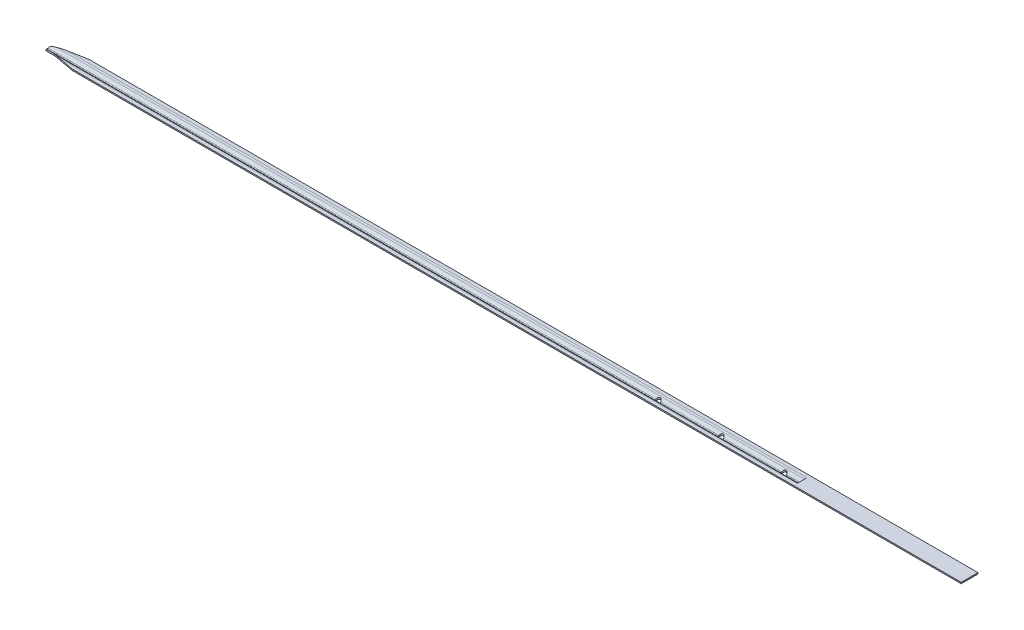
from build123d import *

# Parameters (mm, degrees)
EXTRUDE_1_DEPTH          = 900
SKETCH_6_W               = 20
SKETCH_6_H               = 1.5
EXTRUDE_2_DEPTH          = 200
CUT_EXTRUDE_1_DEPTH      = 901.06900951
CUT_EXTRUDE_1_DEPTH_BACK = 901.06900951
CUT_EXTRUDE_2_DEPTH      = 901.06900961
CUT_EXTRUDE_2_DEPTH_BACK = 901.06900961
SKETCH_3_R               = 3


with BuildPart() as part:
    # Эскиз5 → Бобышка-Вытянуть1 (new body)
    with BuildSketch(Plane(origin=(0, 0, 0), x_dir=(0, 0, -1), z_dir=(1, 0, 0))):
        with BuildLine():
            Line((-10, -0.75), (-5.828427125, -0.75))
            ThreePointArc((-5.828427125, -0.75), (-5.350072834, -0.845150584), (-4.944543648, -1.116116524))
            Line((-4.944543648, -1.116116524), (-1.944543648, -4.116116524))
            ThreePointArc((-1.944543648, -4.116116524), (0, -4.921572875), (1.944543648, -4.116116524))
            Line((1.944543648, -4.116116524), (4.944543648, -1.116116524))
            ThreePointArc((4.944543648, -1.116116524), (5.350072834, -0.845150584), (5.828427125, -0.75))
            Line((5.828427125, -0.75), (10, -0.75))
            Line((10, -0.75), (10, 0.75))
            Line((10, 0.75), (5.828427125, 0.75))
            ThreePointArc((5.828427125, 0.75), (4.776047686, 0.540668714), (3.883883476, -0.055456352))
            Line((3.883883476, -0.055456352), (0.883883476, -3.055456352))
            ThreePointArc((0.883883476, -3.055456352), (0, -3.421572875), (-0.883883476, -3.055456352))
            Line((-0.883883476, -3.055456352), (-3.883883476, -0.055456352))
            ThreePointArc((-3.883883476, -0.055456352), (-4.776047686, 0.540668714), (-5.828427125, 0.75))
            Line((-5.828427125, 0.75), (-10, 0.75))
            Line((-10, 0.75), (-10, -0.75))
        make_face()
    extrude(amount=-EXTRUDE_1_DEPTH)

    # Эскиз6 → Бобышка-Вытянуть2 (add)
    with BuildSketch(Plane(origin=(0, 0, 0), x_dir=(0, 0, -1), z_dir=(1, 0, 0))):
        Rectangle(SKETCH_6_W, SKETCH_6_H)
    extrude(amount=EXTRUDE_2_DEPTH)

    # Эскиз2 → Вырез-Вытянуть1 (cut, two sides: drawn at the far end of the back side and taken through both)
    with BuildSketch(Plane(origin=(0, 0, 0), x_dir=(1, 0, 0), z_dir=(0, 1, 0)).offset(-CUT_EXTRUDE_1_DEPTH_BACK)):
        with BuildLine():
            Line((1233.785324309, -403.154628875), (-860, -10))
            Line((-860, -10), (-897.553640838, -2.948471099))
            ThreePointArc((-897.553640838, -2.948471099), (-900, 0), (-897.553640838, 2.948471099))
            Line((-897.553640838, 2.948471099), (-860, 10))
            Line((-860, 10), (1233.785324309, 403.154628875))
            Line((1233.785324309, 403.154628875), (-3026.969325514, 403.154628875))
            Line((-3026.969325514, 403.154628875), (-3026.969325514, -403.154628875))
            Line((-3026.969325514, -403.154628875), (1233.785324309, -403.154628875))
        make_face()
    extrude(amount=CUT_EXTRUDE_1_DEPTH + CUT_EXTRUDE_1_DEPTH_BACK, mode=Mode.SUBTRACT)

    # Эскиз3 → Вырез-Вытянуть2 (cut, two sides: drawn at the far end of the back side and taken through both)
    with BuildSketch(Plane(origin=(0, 0, 0), x_dir=(1, 0, 0), z_dir=(0, 1, 0)).offset(-CUT_EXTRUDE_2_DEPTH_BACK)):
        with Locations((-22, 0)):
            Circle(SKETCH_3_R)
        with Locations((-172, 0)):
            Circle(SKETCH_3_R)
        with Locations((-97, 0)):
            Circle(SKETCH_3_R)
    extrude(amount=CUT_EXTRUDE_2_DEPTH + CUT_EXTRUDE_2_DEPTH_BACK, mode=Mode.SUBTRACT)


solid = part.part
